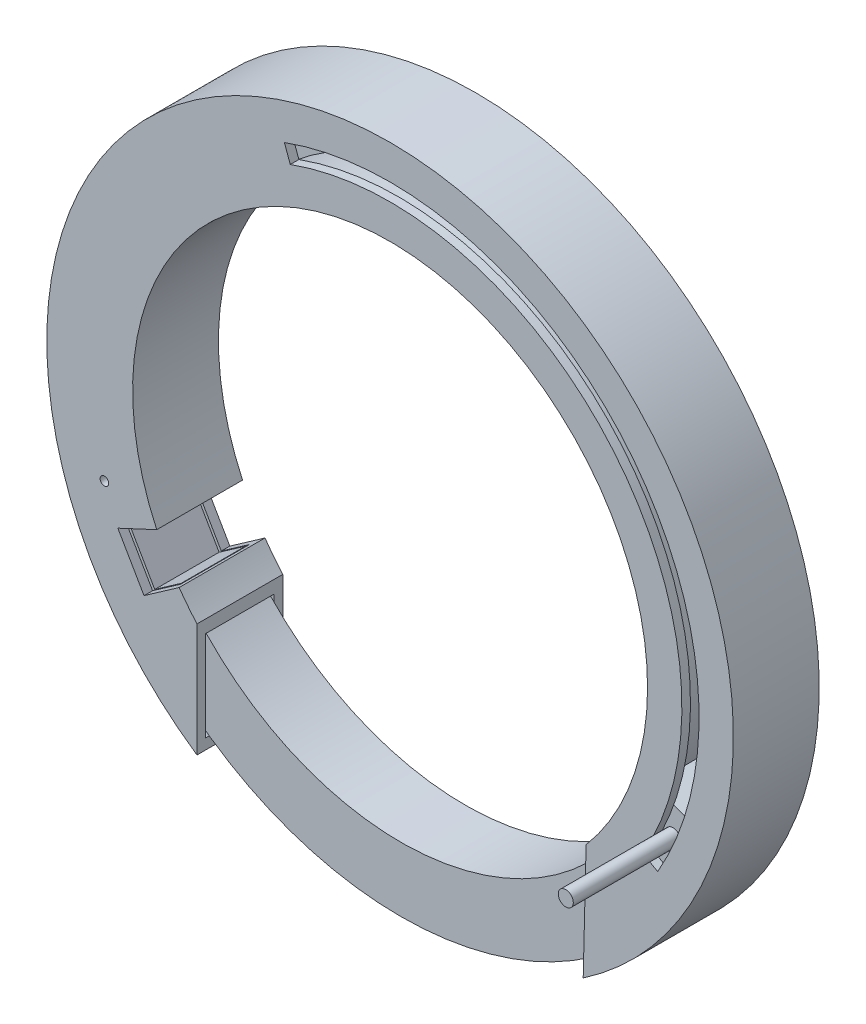
from build123d import *

# Parameters (mm, degrees)
BOSS_EXTRUDE7_DEPTH  = 20
SHELL3_T             = -2
CUT_EXTRUDE4_DEPTH   = 2
SKETCH17_R           = 1
CUT_EXTRUDE5_DEPTH   = 3
BOSS_EXTRUDE11_START = -20
BOSS_EXTRUDE11_DEPTH = 20
BOSS_EXTRUDE12_START = 2.5
BOSS_EXTRUDE12_DEPTH = 15
CUT_EXTRUDE6_START   = -20
CUT_EXTRUDE6_DEPTH   = 20
BOSS_EXTRUDE14_START = 2.5
BOSS_EXTRUDE14_DEPTH = 40


# Read off the part's stored shape, not the designer's step: Cut-Extrude6
with BuildPart() as part:
    # Sketch12 → Boss-Extrude7 (new body)
    with BuildSketch(Plane.XY):
        with BuildLine():
            Line((-45, -66.143782777), (-45, -39.686269666))
            ThreePointArc((-45, -39.686269666), (-0.517840004, 59.997765306), (45.678308464, -38.903626256))
            Line((45.678308464, -38.903626256), (45, -66.143782777))
            ThreePointArc((45, -66.143782777), (0, 80), (-45, -66.143782777))
        make_face()
    extrude(amount=BOSS_EXTRUDE7_DEPTH)

    # Shell3
    shell3_openings = [part.faces().sort_by_distance(p)[0] for p in [
        (45.339154232, -52.523704516, 10),
        (-45, -52.915026221, 10),
    ]]
    offset(amount=SHELL3_T, openings=shell3_openings, kind=Kind.INTERSECTION)

    # Sketch15 → Cut-Extrude4 (cut)
    with BuildSketch(Plane.XY.offset(20)):
        with BuildLine():
            Line((58.889727457, -34), (62.353829072, -36))
            ThreePointArc((62.353829072, -36), (55.155199905, 46.280707897), (-24.625450319, 67.657868697))
            Line((-24.625450319, 67.657868697), (-23.257369746, 63.899098213))
            ThreePointArc((-23.257369746, 63.899098213), (52.091022132, 43.709557459), (58.889727457, -34))
        make_face()
    extrude(amount=-CUT_EXTRUDE4_DEPTH, mode=Mode.SUBTRACT)

    # Sketch17 → Cut-Extrude5 (cut)
    with BuildSketch(Plane.XY.offset(20)):
        with Locations((-66.573956141, -21.631189606)):
            Circle(SKETCH17_R)
    extrude(amount=-CUT_EXTRUDE5_DEPTH, mode=Mode.SUBTRACT)

    # Sketch17<4> → Boss-Extrude11 (add)
    with BuildSketch(Plane.XY.offset(20).offset(BOSS_EXTRUDE11_START)):
        with BuildLine():
            Line((-76.504380477, -23.389736378), (-57.378285358, -17.542302283))
            ThreePointArc((-57.378285358, -17.542302283), (-57.675701756, -16.538241349), (-57.955549577, -15.529142706))
            Line((-57.955549577, -15.529142706), (-77.274066103, -20.705523608))
            ThreePointArc((-77.274066103, -20.705523608), (-76.900935675, -22.050988465), (-76.504380477, -23.389736378))
        make_face()
    extrude(amount=BOSS_EXTRUDE11_DEPTH)


with BuildPart() as body_2:
    # Sketch19 → Boss-Extrude12 (new body)
    with BuildSketch(Plane.XY.offset(BOSS_EXTRUDE12_START)):
        with BuildLine():
            Line((-58.730788799, -21.376258958), (-72.826178111, -26.506561108))
            ThreePointArc((-72.826178111, -26.506561108), (0, -77.5), (72.826178111, -26.506561108))
            Line((72.826178111, -26.506561108), (58.730788799, -21.376258958))
            ThreePointArc((58.730788799, -21.376258958), (0, -62.5), (-58.730788799, -21.376258958))
        make_face()
    extrude(amount=BOSS_EXTRUDE12_DEPTH)


with BuildPart() as cut_extrude6_tool:
    # Cut-Extrude6 outline → Cut-Extrude6 (new body)
    with BuildSketch(Plane(origin=(0, 0, 0), x_dir=(-1, 0, 0), z_dir=(0, 0, -1)).offset(CUT_EXTRUDE6_START)):
        with BuildLine():
            Line((51.197002768, -35.848527272), (57.3406431, -40.150350545))
            Line((57.3406431, -40.150350545), (63.441545093, -29.583278322))
            Line((63.441545093, -29.583278322), (56.64423669, -26.413641359))
            Line((56.64423669, -26.413641359), (54.378467222, -25.357095704))
            ThreePointArc((54.378467222, -25.357095704), (51.961524227, -30), (49.149122657, -34.414586181))
            Line((49.149122657, -34.414586181), (51.197002768, -35.848527272))
        make_face()
    extrude(amount=CUT_EXTRUDE6_DEPTH)


with BuildPart() as part_1:
    add(part.part)

    # Cut-Extrude6: cut by cut_extrude6_tool
    add(cut_extrude6_tool.part, mode=Mode.SUBTRACT)


with BuildPart() as body_2_1:
    add(body_2.part)

    # Cut-Extrude6: cut by cut_extrude6_tool
    add(cut_extrude6_tool.part, mode=Mode.SUBTRACT)

    # Sketch19<5> → Boss-Extrude14 (add)
    with BuildSketch(Plane.XY.offset(BOSS_EXTRUDE14_START)):
        with BuildLine():
            ThreePointArc((65.191545093, -29.583278322), (63.820314417, -27.874760309), (61.855506465, -28.843696364))
            Line((61.855506465, -28.843696364), (65.02758372, -30.32286028))
            ThreePointArc((65.02758372, -30.32286028), (65.150063105, -29.962047646), (65.191545093, -29.583278322))
        make_face()
        with BuildLine():
            Line((65.02758372, -30.32286028), (61.855506465, -28.843696364))
            ThreePointArc((61.855506465, -28.843696364), (62.701963135, -31.169316949), (65.02758372, -30.32286028))
        make_face()
    extrude(amount=BOSS_EXTRUDE14_DEPTH)


solid = Compound([part_1.part, body_2_1.part])
